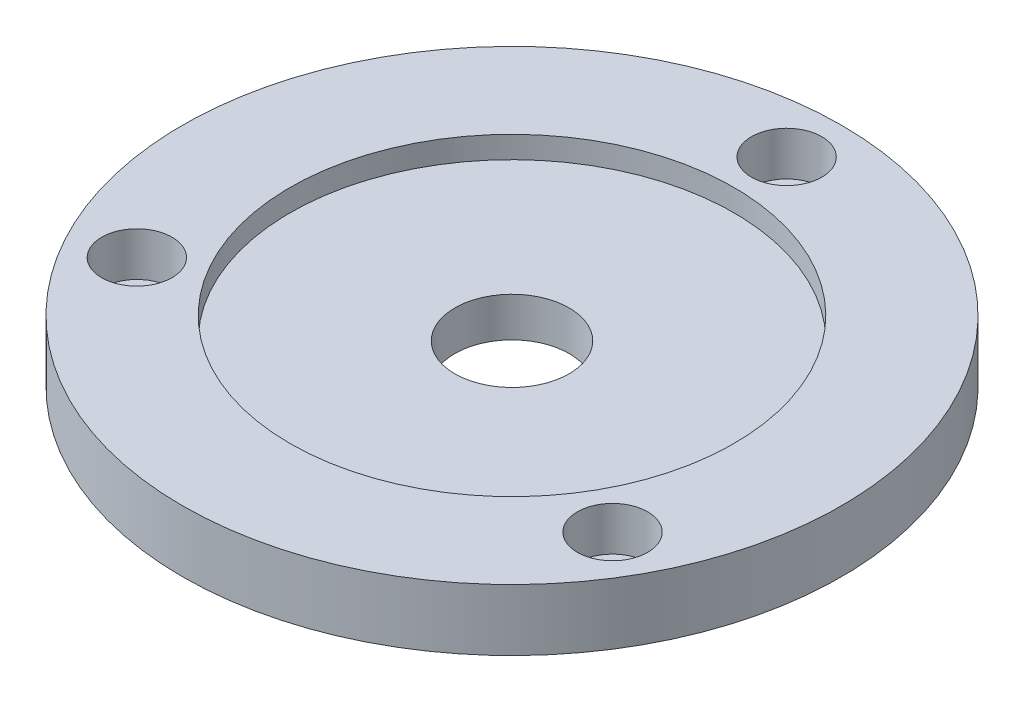
from build123d import *

# Parameters (mm, degrees)
SKETCH1_R           = 75
BOSS_EXTRUDE1_DEPTH = 14
SKETCH4_R           = 5
CUT_EXTRUDE4_DEPTH  = 107.98598039
SKETCH2_R           = 13
CUT_EXTRUDE5_DEPTH  = 107.98598039
SKETCH5_R           = 50.5
CUT_EXTRUDE6_DEPTH  = 5
SKETCH6_R           = 8
CUT_EXTRUDE7_DEPTH  = 10


with BuildPart() as part:
    # Sketch1 → Boss-Extrude1 (new body)
    with BuildSketch(Plane(origin=(0, 0, 0), x_dir=(1, 0, 0), z_dir=(0, 1, 0))):
        Circle(SKETCH1_R)
    extrude(amount=BOSS_EXTRUDE1_DEPTH)

    # Sketch4 → Cut-Extrude4 (cut, through all)
    with BuildSketch(Plane(origin=(0, 14, 0), x_dir=(1, 0, 0), z_dir=(0, 1, 0))):
        with Locations((0, 62.5)):
            Circle(SKETCH4_R)
        with Locations((-54.126587737, -31.25)):
            Circle(SKETCH4_R)
        with Locations((54.126587737, -31.25)):
            Circle(SKETCH4_R)
    extrude(amount=-CUT_EXTRUDE4_DEPTH, mode=Mode.SUBTRACT)

    # Sketch2 → Cut-Extrude5 (cut, through all)
    with BuildSketch(Plane(origin=(0, 14, 0), x_dir=(1, 0, 0), z_dir=(0, 1, 0))):
        Circle(SKETCH2_R)
    extrude(amount=-CUT_EXTRUDE5_DEPTH, mode=Mode.SUBTRACT)

    # Sketch5 → Cut-Extrude6 (cut)
    with BuildSketch(Plane(origin=(0, 14, 0), x_dir=(-1, 0, 0), z_dir=(0, 1, 0))):
        Circle(SKETCH5_R)
    extrude(amount=-CUT_EXTRUDE6_DEPTH, mode=Mode.SUBTRACT)

    # Sketch6 → Cut-Extrude7 (cut)
    with BuildSketch(Plane(origin=(0, 14, 0), x_dir=(1, 0, 0), z_dir=(0, 1, 0))):
        with Locations((-54.126587737, -31.25)):
            Circle(SKETCH6_R)
        with Locations((0, 62.5)):
            Circle(SKETCH6_R)
        with Locations((54.126587737, -31.25)):
            Circle(SKETCH6_R)
    extrude(amount=-CUT_EXTRUDE7_DEPTH, mode=Mode.SUBTRACT)


solid = part.part
